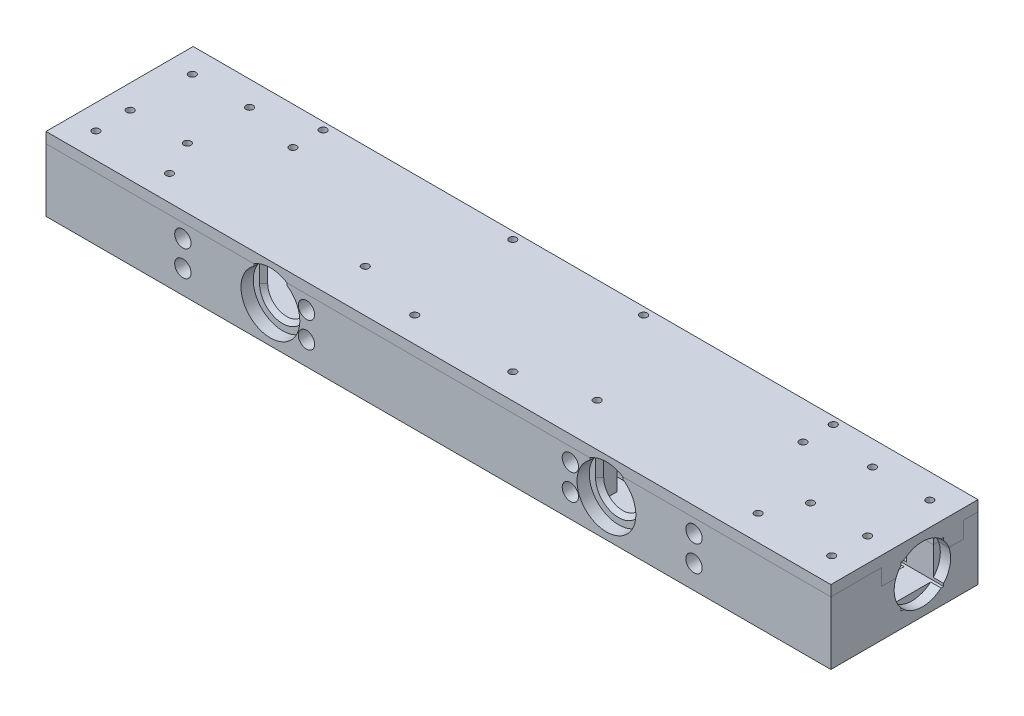
from build123d import *

# Parameters (mm, degrees)
BOSS_EXTRUDE1_DEPTH      = 152.4
BOSS_EXTRUDE1_DEPTH_BACK = 152.4
SKETCH3_W                = 57.15
SKETCH3_H                = 28.575
SKETCH6_W                = 16.51
SKETCH6_H                = 16.51
CUT_EXTRUDE2_DEPTH       = 16.9164
SKETCH7_R                = 10.9728
CUT_EXTRUDE3_DEPTH       = 4.0132
CUT_EXTRUDE4_START       = 2.54
SKETCH8_R                = 10.9728
CUT_EXTRUDE4_DEPTH       = 2.54
CUT_EXTRUDE5_DEPTH       = 25.4
SPLIT1_SURFACE_1_BACK    = 312.425
SPLIT1_SURFACE_1_DEPTH   = 624.85
SPLIT1_SURFACE_2_BACK    = 312.425
SPLIT1_SURFACE_2_DEPTH   = 624.85
CUT_EXTRUDE7_START       = 4.1275
CUT_EXTRUDE7_DEPTH       = 20.32
CUT_EXTRUDE8_DEPTH       = 6.35
SKETCH16_W               = 7.15
SKETCH16_H               = 5.08
CUT_EXTRUDE9_DEPTH       = 20.32
SKETCH17_W               = 7.62
SKETCH17_H               = 26.665
BOSS_EXTRUDE2_DEPTH      = 6.35
SKETCH18_W               = 55.24
SKETCH18_H               = 5.085
BOSS_EXTRUDE3_DEPTH      = 9.525
SKETCH19_W               = 8
SKETCH19_H               = 7.62
CUT_EXTRUDE10_DEPTH      = 7.62
CUT_EXTRUDE11_REACH      = 169.532
SKETCH20_R               = 3.175
SKETCH21_R               = 1.397
CUT_EXTRUDE12_DEPTH      = 25.4
SKETCH28_R               = 11.43
CUT_EXTRUDE16_DEPTH      = 4.7625
BOSS_EXTRUDE5_REACH      = 160.392
SKETCH23_W               = 7.2136
SKETCH23_H               = 6.35
SKETCH24_W               = 55.24
SKETCH24_H               = 5.085
BOSS_EXTRUDE6_DEPTH      = 3.175
SKETCH25_W               = 205.74
SKETCH25_H               = 26.665
CUT_EXTRUDE13_DEPTH      = 6.35
SKETCH26_R               = 1.397
CUT_EXTRUDE14_DEPTH      = 25.4
CUT_EXTRUDE15_DEPTH      = 20.32
CUT_EXTRUDE17_DEPTH      = 6.35


with BuildPart() as part:
    # Sketch3 → Boss-Extrude1 (new, two sides: drawn at the far end of the back side and taken through both)
    with BuildSketch(Plane(origin=(0, 0, 0), x_dir=(0, 0, -1), z_dir=(1, 0, 0)).offset(-BOSS_EXTRUDE1_DEPTH_BACK)):
        with Locations((-6.985, 25.4)):
            Rectangle(SKETCH3_W, SKETCH3_H)
    extrude(amount=BOSS_EXTRUDE1_DEPTH + BOSS_EXTRUDE1_DEPTH_BACK)

    # Sketch6 → Cut-Extrude2 (cut)
    with BuildSketch(Plane(origin=(152.4, 0, 0), x_dir=(0, 0, -1), z_dir=(1, 0, 0))):
        with Locations((0, 25.4)):
            Rectangle(SKETCH6_W, SKETCH6_H)
    cut_extrude2 = extrude(amount=-CUT_EXTRUDE2_DEPTH, mode=Mode.SUBTRACT)

    # Sketch7 → Cut-Extrude3 (cut)
    with BuildSketch(Plane(origin=(152.4, 0, 0), x_dir=(0, 0, -1), z_dir=(1, 0, 0))):
        with Locations((0, 25.4)):
            Circle(SKETCH7_R)
    cut_extrude3 = extrude(amount=-CUT_EXTRUDE3_DEPTH, mode=Mode.SUBTRACT)

    # Sketch8 → Cut-Extrude4 (cut)
    with BuildSketch(Plane(origin=(135.4836, 0, 0), x_dir=(0, 0, -1), z_dir=(1, 0, 0)).offset(CUT_EXTRUDE4_START)):
        with Locations((0, 25.4)):
            Circle(SKETCH8_R)
    cut_extrude4 = extrude(amount=-CUT_EXTRUDE4_DEPTH, mode=Mode.SUBTRACT)

    # Sketch9 → Cut-Extrude5 (cut)
    with BuildSketch(Plane(origin=(135.4836, 0, 0), x_dir=(0, 0, -1), z_dir=(1, 0, 0))):
        with BuildLine():
            Line((7.74954, 32.033075169), (7.74954, 18.766924831))
            ThreePointArc((7.74954, 18.766924831), (0, 15.19936), (-7.74954, 18.766924831))
            Line((-7.74954, 18.766924831), (-7.74954, 32.033075169))
            ThreePointArc((-7.74954, 32.033075169), (0, 35.60064), (7.74954, 32.033075169))
        make_face()
    cut_extrude5 = extrude(amount=-CUT_EXTRUDE5_DEPTH, mode=Mode.SUBTRACT)

    # Mirror1: Cut-Extrude2, Cut-Extrude3, Cut-Extrude4, Cut-Extrude5 across Right Plane
    add(cut_extrude2.mirror(Plane(origin=(0, 0, 0), x_dir=(0, 0, -1), z_dir=(1, 0, 0))), mode=Mode.SUBTRACT)
    add(cut_extrude3.mirror(Plane(origin=(0, 0, 0), x_dir=(0, 0, -1), z_dir=(1, 0, 0))), mode=Mode.SUBTRACT)
    add(cut_extrude4.mirror(Plane(origin=(0, 0, 0), x_dir=(0, 0, -1), z_dir=(1, 0, 0))), mode=Mode.SUBTRACT)
    add(cut_extrude5.mirror(Plane(origin=(0, 0, 0), x_dir=(0, 0, -1), z_dir=(1, 0, 0))), mode=Mode.SUBTRACT)


with BuildPart() as body_2:
    # Split1: the piece behind the surface
    add(part.part)
    # Split1 surface: a surface, the sketch's curves swept straight by 624.85 mm
    with BuildLine(Plane(origin=(0, 0, 0), x_dir=(0, 0, -1), z_dir=(1, 0, 0)).offset(-SPLIT1_SURFACE_1_BACK), mode=Mode.PRIVATE) as split1_surface_1_path:
        Line((-35.56, 35.56), (-15.875, 35.56))
        Line((-15.875, 35.56), (-15.875, 29.21))
        Line((-15.875, 29.21), (0, 29.21))
        Line((0, 29.21), (15.875, 29.21))
        Line((15.875, 29.21), (15.875, 35.56))
        Line((15.875, 35.56), (21.59, 35.56))
    split1_surface_1 = Shell.extrude(split1_surface_1_path.wire(), (1 * SPLIT1_SURFACE_1_DEPTH, 0 * SPLIT1_SURFACE_1_DEPTH, 0 * SPLIT1_SURFACE_1_DEPTH))
    split(bisect_by=split1_surface_1, keep=Keep.BOTTOM)


with BuildPart() as part_1:
    add(part.part)

    # Split1: split by a surface, the side it looks to stays
    # Split1 surface: a surface, the sketch's curves swept straight by 624.85 mm
    with BuildLine(Plane(origin=(0, 0, 0), x_dir=(0, 0, -1), z_dir=(1, 0, 0)).offset(-SPLIT1_SURFACE_2_BACK), mode=Mode.PRIVATE) as split1_surface_2_path:
        Line((-35.56, 35.56), (-15.875, 35.56))
        Line((-15.875, 35.56), (-15.875, 29.21))
        Line((-15.875, 29.21), (0, 29.21))
        Line((0, 29.21), (15.875, 29.21))
        Line((15.875, 29.21), (15.875, 35.56))
        Line((15.875, 35.56), (21.59, 35.56))
    split1_surface_2 = Shell.extrude(split1_surface_2_path.wire(), (1 * SPLIT1_SURFACE_2_DEPTH, 0 * SPLIT1_SURFACE_2_DEPTH, 0 * SPLIT1_SURFACE_2_DEPTH))
    split(bisect_by=split1_surface_2, keep=Keep.TOP)


with BuildPart() as cut_extrude7_tool:
    # Sketch13 → Cut-Extrude7 (new body)
    with BuildSketch(Plane(origin=(0, 11.1125, 0), x_dir=(1, 0, 0), z_dir=(0, 1, 0)).offset(CUT_EXTRUDE7_START)):
        Polygon((-102.87, -15.875), (-102.87, 10.79), (-95.25, 10.79), (-95.25, -29.21), (-55.25, -29.21), (-55.25, 10.79), (-47.63, 10.79), (-47.63, -15.875), (47.63, -15.875), (47.63, 10.79), (55.25, 10.79), (55.25, -29.21), (95.25, -29.21), (95.25, 10.79), (102.87, 10.79), (102.87, -15.875), (110.0836, -15.875), (110.0836, 15.875), (-110.0836, 15.875), (-110.0836, -15.875), align=None)
    extrude(amount=CUT_EXTRUDE7_DEPTH)


with BuildPart() as part_2:
    add(part_1.part)

    # Cut-Extrude7: cut by cut_extrude7_tool
    add(cut_extrude7_tool.part, mode=Mode.SUBTRACT)

    # Sketch24 → Boss-Extrude6 (add)
    with BuildSketch(Plane.XZ.offset(-35.56)):
        with Locations((-75.25, -13.3325)):
            Rectangle(SKETCH24_W, SKETCH24_H)
        with Locations((75.25, -13.3325)):
            Rectangle(SKETCH24_W, SKETCH24_H)
    extrude(amount=BOSS_EXTRUDE6_DEPTH)

    # Sketch25 → Cut-Extrude13 (cut)
    with BuildSketch(Plane.XZ.offset(-29.21)):
        with Locations((0, 2.5425)):
            Rectangle(SKETCH25_W, SKETCH25_H)
    extrude(amount=-CUT_EXTRUDE13_DEPTH, mode=Mode.SUBTRACT)


with BuildPart() as body_2_1:
    add(body_2.part)

    # Cut-Extrude7: cut by cut_extrude7_tool
    add(cut_extrude7_tool.part, mode=Mode.SUBTRACT)

    # Sketch15 → Cut-Extrude8 (cut)
    with BuildSketch(Plane.XY.offset(35.56)):
        with BuildLine():
            Line((-71.7, 25.24), (-71.7, 35.56))
            Line((-71.7, 35.56), (-58.8, 35.56))
            Line((-58.8, 35.56), (-58.8, 25.24))
            ThreePointArc((-58.8, 25.24), (-65.25, 18.79), (-71.7, 25.24))
        make_face()
    cut_extrude8 = extrude(amount=-CUT_EXTRUDE8_DEPTH, mode=Mode.SUBTRACT)

    # Sketch16 → Cut-Extrude9 (cut)
    with BuildSketch(Plane(origin=(0, 35.56, 0), x_dir=(1, 0, 0), z_dir=(0, 1.0, 1.17890261829277e-12))):
        with Locations((-98.825, -18.95)):
            Rectangle(SKETCH16_W, SKETCH16_H)
        with Locations((-51.675, -18.95)):
            Rectangle(SKETCH16_W, SKETCH16_H)
    cut_extrude9 = extrude(amount=-CUT_EXTRUDE9_DEPTH, mode=Mode.SUBTRACT)

    # Sketch17 → Boss-Extrude2 (add)
    with BuildSketch(Plane(origin=(0, 29.21, 0), x_dir=(1, 0, 0), z_dir=(0, 1, 0))):
        with Locations((-99.06, -2.5425)):
            Rectangle(SKETCH17_W, SKETCH17_H)
        with Locations((-51.44, -2.5425)):
            Rectangle(SKETCH17_W, SKETCH17_H)
    boss_extrude2 = extrude(amount=BOSS_EXTRUDE2_DEPTH)

    # Sketch18 → Boss-Extrude3 (add)
    with BuildSketch(Plane(origin=(0, 15.24, 0), x_dir=(1, 0, 0), z_dir=(0, 1, 0))):
        with Locations((-75.25, 13.3325)):
            Rectangle(SKETCH18_W, SKETCH18_H)
    boss_extrude3 = extrude(amount=BOSS_EXTRUDE3_DEPTH)

    # Sketch19 → Cut-Extrude10 (cut)
    with BuildSketch(Plane.ZY.offset(55.25)):
        with Locations((-6.79, 25.4)):
            Rectangle(SKETCH19_W, SKETCH19_H)
    cut_extrude10 = extrude(amount=-CUT_EXTRUDE10_DEPTH, mode=Mode.SUBTRACT)

    # Cut-Extrude11: up to this face of the body (flat: up to its plane)
    cut_extrude11_end = Plane(body_2_1.part.faces().sort_by_distance((-98.825, 25.4, 16.41))[0])
    # Sketch20 → Cut-Extrude11 (cut, up to the picked face)
    with BuildSketch(Plane.XY.offset(35.56), mode=Mode.PRIVATE) as cut_extrude11_sk1:
        with Locations((-99.25, 20.24)):
            Circle(SKETCH20_R)
    cut_extrude11_tool1 = split(extrude(cut_extrude11_sk1.sketch, amount=-CUT_EXTRUDE11_REACH, mode=Mode.PRIVATE), bisect_by=cut_extrude11_end, keep=Keep.BOTH, mode=Mode.PRIVATE)
    # Sketch20 → Cut-Extrude11 (cut, up to the picked face)
    with BuildSketch(Plane.XY.offset(35.56), mode=Mode.PRIVATE) as cut_extrude11_sk2:
        with Locations((-99.25, 30.24)):
            Circle(SKETCH20_R)
    cut_extrude11_tool2 = split(extrude(cut_extrude11_sk2.sketch, amount=-CUT_EXTRUDE11_REACH, mode=Mode.PRIVATE), bisect_by=cut_extrude11_end, keep=Keep.BOTH, mode=Mode.PRIVATE)
    # Sketch20 → Cut-Extrude11 (cut, up to the picked face)
    with BuildSketch(Plane.XY.offset(35.56), mode=Mode.PRIVATE) as cut_extrude11_sk3:
        with Locations((-51.25, 20.24)):
            Circle(SKETCH20_R)
    cut_extrude11_tool3 = split(extrude(cut_extrude11_sk3.sketch, amount=-CUT_EXTRUDE11_REACH, mode=Mode.PRIVATE), bisect_by=cut_extrude11_end, keep=Keep.BOTH, mode=Mode.PRIVATE)
    # Sketch20 → Cut-Extrude11 (cut, up to the picked face)
    with BuildSketch(Plane.XY.offset(35.56), mode=Mode.PRIVATE) as cut_extrude11_sk4:
        with Locations((-51.25, 30.24)):
            Circle(SKETCH20_R)
    cut_extrude11_tool4 = split(extrude(cut_extrude11_sk4.sketch, amount=-CUT_EXTRUDE11_REACH, mode=Mode.PRIVATE), bisect_by=cut_extrude11_end, keep=Keep.BOTH, mode=Mode.PRIVATE)
    cut_extrude11_1 = cut_extrude11_tool1.solids().sort_by(Axis((-99.25, 20.24, 35.56), (0, 0, -1)))[0]
    add(cut_extrude11_1, mode=Mode.SUBTRACT)
    cut_extrude11_2 = cut_extrude11_tool2.solids().sort_by(Axis((-99.25, 30.24, 35.56), (0, 0, -1)))[0]
    add(cut_extrude11_2, mode=Mode.SUBTRACT)
    cut_extrude11_3 = cut_extrude11_tool3.solids().sort_by(Axis((-51.25, 20.24, 35.56), (0, 0, -1)))[0]
    add(cut_extrude11_3, mode=Mode.SUBTRACT)
    cut_extrude11_4 = cut_extrude11_tool4.solids().sort_by(Axis((-51.25, 30.24, 35.56), (0, 0, -1)))[0]
    add(cut_extrude11_4, mode=Mode.SUBTRACT)
    cut_extrude11 = cut_extrude11_1 + cut_extrude11_2 + cut_extrude11_3 + cut_extrude11_4  # Cut-Extrude11 as one shape, for the pattern or mirror that repeats it

    # Sketch21 → Cut-Extrude12 (cut)
    with BuildSketch(Plane.XY.offset(16.41)):
        with Locations(Location((-99.25, 30.24, 0), (0, 0, 270))):
            Circle(SKETCH21_R)
        with Locations(Location((-99.25, 20.24, 0), (0, 0, 270))):
            Circle(SKETCH21_R)
        with Locations(Location((-51.25, 20.24, 0), (0, 0, 270))):
            Circle(SKETCH21_R)
        with Locations(Location((-51.25, 30.24, 0), (0, 0, 270))):
            Circle(SKETCH21_R)
    cut_extrude12 = extrude(amount=-CUT_EXTRUDE12_DEPTH, mode=Mode.SUBTRACT)

    # Sketch28 → Cut-Extrude16 (cut)
    with BuildSketch(Plane.XY.offset(35.56)):
        with Locations((-65.25, 25.24)):
            Circle(SKETCH28_R)
    cut_extrude16 = extrude(amount=-CUT_EXTRUDE16_DEPTH, mode=Mode.SUBTRACT)

    # Mirror2: Cut-Extrude8, Cut-Extrude9 across plane
    add(cut_extrude8.mirror(Plane(origin=(0, 0, 0), x_dir=(0, 0, 1), z_dir=(1, 0, 0))), mode=Mode.SUBTRACT)
    add(cut_extrude9.mirror(Plane(origin=(0, 0, 0), x_dir=(0, 0, 1), z_dir=(1, 0, 0))), mode=Mode.SUBTRACT)

    # Mirror2 2: Boss-Extrude2, Boss-Extrude3 across plane
    add(boss_extrude2.mirror(Plane(origin=(0, 0, 0), x_dir=(0, 0, 1), z_dir=(1, 0, 0))))
    add(boss_extrude3.mirror(Plane(origin=(0, 0, 0), x_dir=(0, 0, 1), z_dir=(1, 0, 0))))

    # Mirror2 3: Cut-Extrude10, Cut-Extrude11, Cut-Extrude12, Cut-Extrude16 across plane
    add(cut_extrude10.mirror(Plane(origin=(0, 0, 0), x_dir=(0, 0, 1), z_dir=(1, 0, 0))), mode=Mode.SUBTRACT)
    add(cut_extrude11.mirror(Plane(origin=(0, 0, 0), x_dir=(0, 0, 1), z_dir=(1, 0, 0))), mode=Mode.SUBTRACT)
    add(cut_extrude12.mirror(Plane(origin=(0, 0, 0), x_dir=(0, 0, 1), z_dir=(1, 0, 0))), mode=Mode.SUBTRACT)
    add(cut_extrude16.mirror(Plane(origin=(0, 0, 0), x_dir=(0, 0, 1), z_dir=(1, 0, 0))), mode=Mode.SUBTRACT)

    # Boss-Extrude5: up to this face of the body (flat: up to its plane)
    boss_extrude5_end = Plane(body_2_1.part.faces().sort_by_distance((106.4768, 15.24, 0))[0])
    # Sketch23 → Boss-Extrude5 (add, up to the picked face)
    with BuildSketch(Plane(origin=(0, 35.56, 0), x_dir=(1, 0, 0), z_dir=(0, 1.0, 1.17890261829277e-12)), mode=Mode.PRIVATE) as boss_extrude5_sk1:
        with Locations((-106.4768, -12.7)):
            Rectangle(SKETCH23_W, SKETCH23_H)
    boss_extrude5_tool1 = split(extrude(boss_extrude5_sk1.sketch, amount=-BOSS_EXTRUDE5_REACH, mode=Mode.PRIVATE), bisect_by=boss_extrude5_end, keep=Keep.BOTH, mode=Mode.PRIVATE)
    # Sketch23 → Boss-Extrude5 (add, up to the picked face)
    with BuildSketch(Plane(origin=(0, 35.56, 0), x_dir=(1, 0, 0), z_dir=(0, 1.0, 1.17890261829277e-12)), mode=Mode.PRIVATE) as boss_extrude5_sk2:
        with Locations((106.4768, -12.7)):
            Rectangle(SKETCH23_W, SKETCH23_H)
    boss_extrude5_tool2 = split(extrude(boss_extrude5_sk2.sketch, amount=-BOSS_EXTRUDE5_REACH, mode=Mode.PRIVATE), bisect_by=boss_extrude5_end, keep=Keep.BOTH, mode=Mode.PRIVATE)
    add(boss_extrude5_tool1.solids().sort_by(Axis((-106.4768, 35.56, 12.7), (0, -1.0, -1.17890261829277e-12)))[0])
    add(boss_extrude5_tool2.solids().sort_by(Axis((106.4768, 35.56, 12.7), (0, -1.0, -1.17890261829277e-12)))[0])


with BuildPart() as cut_extrude14_tool:
    # Sketch26 → Cut-Extrude14 (new body)
    with BuildSketch(Plane(origin=(0, 39.6875, 0), x_dir=(1, 0, 0), z_dir=(0, 1, 0))):
        with Locations(Location((-142.875, -25.7175, 0), (0, 0, 270))):
            Circle(SKETCH26_R)
        with Locations(Location((-114.3, -25.7175, 0), (0, 0, 270))):
            Circle(SKETCH26_R)
        with Locations(Location((-99.06, 6.98, 0), (0, 0, 270))):
            Circle(SKETCH26_R)
        with Locations(Location((-143.2052, 12.065, 0), (0, 0, 270))):
            Circle(SKETCH26_R)
        with Locations(Location((-120.9802, 12.065, 0), (0, 0, 270))):
            Circle(SKETCH26_R)
        with Locations(Location((-143.2052, -12.065, 0), (0, 0, 270))):
            Circle(SKETCH26_R)
        with Locations(Location((-120.9802, -12.065, 0), (0, 0, 270))):
            Circle(SKETCH26_R)
        with Locations(Location((-99.06, 18.7325, 0), (0, 0, 270))):
            Circle(SKETCH26_R)
        with Locations(Location((-25.4, 18.7325, 0), (0, 0, 270))):
            Circle(SKETCH26_R)
        with Locations(Location((-45.025, -18.95, 0), (0, 0, 270))):
            Circle(SKETCH26_R)
        with Locations(Location((-19.05, -25.7175, 0), (0, 0, 270))):
            Circle(SKETCH26_R)
    cut_extrude14 = extrude(amount=-CUT_EXTRUDE14_DEPTH)


with BuildPart() as part_3:
    add(part_2.part)

    # Cut-Extrude14: cut by cut_extrude14_tool
    add(cut_extrude14_tool.part, mode=Mode.SUBTRACT)


with BuildPart() as body_2_2:
    add(body_2_1.part)

    # Cut-Extrude14: cut by cut_extrude14_tool
    add(cut_extrude14_tool.part, mode=Mode.SUBTRACT)


with BuildPart() as mirror3_tool:
    # Mirror3: Cut-Extrude14 across plane
    add(cut_extrude14.mirror(Plane(origin=(0, 0, 0), x_dir=(0, 0, 1), z_dir=(1, 0, 0))))


with BuildPart() as part_4:
    add(part_3.part)

    # Mirror3: cut by mirror3_tool
    add(mirror3_tool.part, mode=Mode.SUBTRACT)

    # Sketch31 → Cut-Extrude17 (cut)
    with BuildSketch(Plane.XY.offset(35.56)):
        with BuildLine():
            Line((-71.7, 35.56), (-58.8, 35.56))
            ThreePointArc((-58.8, 35.56), (-65.25, 37.40983566), (-71.7, 35.56))
        make_face()
        with BuildLine():
            Line((58.8, 35.56), (71.7, 35.56))
            ThreePointArc((71.7, 35.56), (65.25, 37.40983566), (58.8, 35.56))
        make_face()
    extrude(amount=-CUT_EXTRUDE17_DEPTH, mode=Mode.SUBTRACT)


with BuildPart() as body_2_3:
    add(body_2_2.part)

    # Mirror3: cut by mirror3_tool
    add(mirror3_tool.part, mode=Mode.SUBTRACT)

    # Sketch27 → Cut-Extrude15 (cut)
    with BuildSketch(Plane(origin=(0, 35.56, 0), x_dir=(1, 0, 0), z_dir=(0, 1.0, 1.17890261829277e-12))):
        Polygon((-40.01, -15.875), (-33.3425, -22.5425), (33.3425, -22.5425), (40.01, -15.875), align=None)
    extrude(amount=-CUT_EXTRUDE15_DEPTH, mode=Mode.SUBTRACT)

    # Chamfer1
    # the kernel refuses this chamfer: 2.54 mm, written as the material it takes off along each edge
    with BuildSketch(Plane(origin=(65.25, 25.24, 30.7975), x_dir=(-1, 0, 0), z_dir=(0, 1, 0))) as chamfer1_piece_1:
        with BuildLine():
            Line((9.061842049, 0.071842049), (6.378157951, -2.611842049))
            Line((6.378157951, -2.611842049), (6.327357951, -2.611842049))
            ThreePointArc((6.327357951, -2.611842049), (6.3992, -1.305921024), (6.3992, 0))
            Line((6.3992, 0), (6.45, 0.0508))
            ThreePointArc((6.45, 0.0508), (7.755921024, 0.0508), (9.061842049, 0.122642049))
            Line((9.061842049, 0.122642049), (9.061842049, 0.071842049))
        make_face()
    revolve(axis=Axis((65.25, 25.24, 30.7975), (0, 0, 1)), revolution_arc=180, mode=Mode.SUBTRACT)
    with BuildSketch(Plane(origin=(-65.25, 25.24, 30.7975), x_dir=(-1, 0, 0), z_dir=(0, 1, 0))) as chamfer1_piece_2:
        with BuildLine():
            Line((9.061842049, 0.071842049), (6.378157951, -2.611842049))
            Line((6.378157951, -2.611842049), (6.327357951, -2.611842049))
            ThreePointArc((6.327357951, -2.611842049), (6.3992, -1.305921024), (6.3992, 0))
            Line((6.3992, 0), (6.45, 0.0508))
            ThreePointArc((6.45, 0.0508), (7.755921024, 0.0508), (9.061842049, 0.122642049))
            Line((9.061842049, 0.122642049), (9.061842049, 0.071842049))
        make_face()
    revolve(axis=Axis((-65.25, 25.24, 30.7975), (0, 0, 1)), revolution_arc=180, mode=Mode.SUBTRACT)
    with BuildSketch(Plane(origin=(58.8, 41.208302849, 30.7975), x_dir=(0.027495876610587302, 0, -0.9996219169112966), z_dir=(0, -1, 0))) as chamfer1_piece_3_section:
        with BuildLine():
            Line((2.612829916, 0), (-0.143629773, -2.608879196))
            Line((-0.143629773, -2.608879196), (-0.194410567, -2.607482405))
            ThreePointArc((-0.194410567, -2.607482405), (-0.086688237, -1.304030487), (-0.050780793, 0.001396791))
            Line((-0.050780793, 0.001396791), (0.001396791, 0.050780793))
            ThreePointArc((0.001396791, 0.050780793), (1.306824068, 0.01487335), (2.614226706, 0.050780793))
            Line((2.614226706, 0.050780793), (2.612829916, 0))
        make_face()
    chamfer1_piece_3 = extrude(amount=15.968302849, mode=Mode.PRIVATE)
    chamfer1_piece_3 = chamfer1_piece_3 & Plane(origin=(65.25, 25.24, 29.938073492), x_dir=(-1, 0, 0), z_dir=(0, 0, 1)) * Cylinder(11.43, 43, mode=Mode.PRIVATE)
    add(chamfer1_piece_3, mode=Mode.SUBTRACT)
    with BuildSketch(Plane(origin=(71.7, 25.24, 30.7975), x_dir=(-0.02749587661058459, 0, -0.9996219169112968), z_dir=(0, 1, 0))) as chamfer1_piece_4_section:
        with BuildLine():
            Line((2.612829916, 0), (-0.143629773, -2.608879196))
            Line((-0.143629773, -2.608879196), (-0.194410567, -2.607482405))
            ThreePointArc((-0.194410567, -2.607482405), (-0.086688237, -1.304030487), (-0.050780793, 0.001396791))
            Line((-0.050780793, 0.001396791), (0.001396791, 0.050780793))
            ThreePointArc((0.001396791, 0.050780793), (1.306824068, 0.01487335), (2.614226706, 0.050780793))
            Line((2.614226706, 0.050780793), (2.612829916, 0))
        make_face()
    chamfer1_piece_4 = extrude(amount=15.968302849, mode=Mode.PRIVATE)
    chamfer1_piece_4 = chamfer1_piece_4 & Plane(origin=(65.25, 25.24, 29.938073501), x_dir=(-1, 0, 0), z_dir=(0, 0, 1)) * Cylinder(11.43, 43, mode=Mode.PRIVATE)
    add(chamfer1_piece_4, mode=Mode.SUBTRACT)
    with BuildSketch(Plane(origin=(-58.8, 25.24, 30.7975), x_dir=(-0.027495876610587302, 0, -0.9996219169112966), z_dir=(0, 1, 0))) as chamfer1_piece_5_section:
        with BuildLine():
            Line((2.612829916, 0), (-0.143629773, -2.608879196))
            Line((-0.143629773, -2.608879196), (-0.194410567, -2.607482405))
            ThreePointArc((-0.194410567, -2.607482405), (-0.086688237, -1.304030487), (-0.050780793, 0.001396791))
            Line((-0.050780793, 0.001396791), (0.001396791, 0.050780793))
            ThreePointArc((0.001396791, 0.050780793), (1.306824068, 0.01487335), (2.614226706, 0.050780793))
            Line((2.614226706, 0.050780793), (2.612829916, 0))
        make_face()
    chamfer1_piece_5 = extrude(amount=15.968302849, mode=Mode.PRIVATE)
    chamfer1_piece_5 = chamfer1_piece_5 & Plane(origin=(-65.25, 25.24, 29.938073492), x_dir=(1, 0, 0), z_dir=(0, 0, 1)) * Cylinder(11.43, 43, mode=Mode.PRIVATE)
    add(chamfer1_piece_5, mode=Mode.SUBTRACT)
    with BuildSketch(Plane(origin=(-71.7, 41.208302849, 30.7975), x_dir=(0.02749587661058459, 0, -0.9996219169112968), z_dir=(0, -1, 0))) as chamfer1_piece_6_section:
        with BuildLine():
            Line((2.612829916, 0), (-0.143629773, -2.608879196))
            Line((-0.143629773, -2.608879196), (-0.194410567, -2.607482405))
            ThreePointArc((-0.194410567, -2.607482405), (-0.086688237, -1.304030487), (-0.050780793, 0.001396791))
            Line((-0.050780793, 0.001396791), (0.001396791, 0.050780793))
            ThreePointArc((0.001396791, 0.050780793), (1.306824068, 0.01487335), (2.614226706, 0.050780793))
            Line((2.614226706, 0.050780793), (2.612829916, 0))
        make_face()
    chamfer1_piece_6 = extrude(amount=15.968302849, mode=Mode.PRIVATE)
    chamfer1_piece_6 = chamfer1_piece_6 & Plane(origin=(-65.25, 25.24, 29.938073501), x_dir=(1, 0, 0), z_dir=(0, 0, 1)) * Cylinder(11.43, 43, mode=Mode.PRIVATE)
    add(chamfer1_piece_6, mode=Mode.SUBTRACT)


solid = Compound([part_4.part, body_2_3.part])
